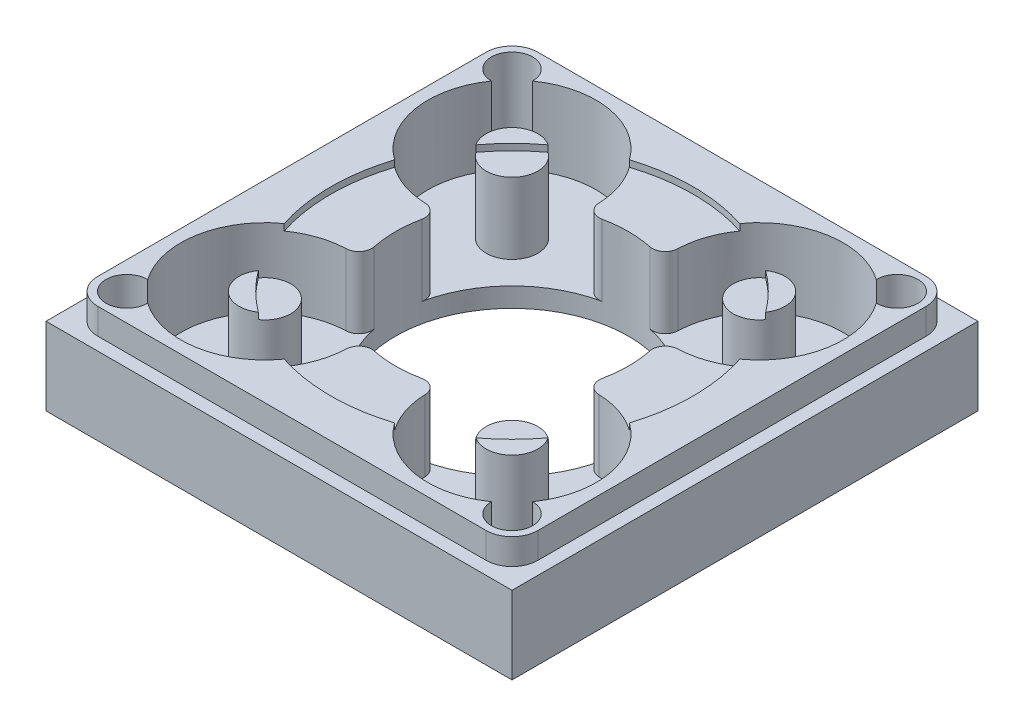
from build123d import *

# Parameters (mm, degrees)
SKETCH1_W           = 57.15
SKETCH1_H           = 57.15
SKETCH1_R           = 14.2875
BOSS_EXTRUDE1_DEPTH = 12.7
SKETCH2_W           = 57.15
SKETCH2_H           = 57.15
CUT_EXTRUDE1_DEPTH  = 3.175
SKETCH4_R           = 10.31875
SKETCH4_R_2         = 3.175
CUT_EXTRUDE3_DEPTH  = 9.525
SKETCH5_R           = 22.225
CUT_EXTRUDE4_DEPTH  = 0.79375
SKETCH6_R           = 2.54
CUT_EXTRUDE5_DEPTH  = 43.359783404
CUT_EXTRUDE6_START  = -0.79375
SKETCH8_R           = 22.225
CUT_EXTRUDE6_DEPTH  = 0.79375
FILLET1_R           = 1.5875


with BuildPart() as part:
    # Sketch1 → Boss-Extrude1 (new body)
    with BuildSketch(Plane(origin=(0, 0, 0), x_dir=(1, 0, 0), z_dir=(0, 1, 0))):
        Rectangle(SKETCH1_W, SKETCH1_H)
        Circle(SKETCH1_R, mode=Mode.SUBTRACT)
    extrude(amount=BOSS_EXTRUDE1_DEPTH)

    # Sketch2 → Cut-Extrude1 (cut)
    with BuildSketch(Plane(origin=(0, 12.7, 0), x_dir=(1, 0, 0), z_dir=(0, 1, 0))):
        Rectangle(SKETCH2_W, SKETCH2_H)
        with BuildLine():
            Line((-23.8125, -26.9875), (23.8125, -26.9875))
            ThreePointArc((23.8125, -26.9875), (26.05756403, -26.05756403), (26.9875, -23.8125))
            Line((26.9875, -23.8125), (26.9875, 23.8125))
            ThreePointArc((26.9875, 23.8125), (26.05756403, 26.05756403), (23.8125, 26.9875))
            Line((23.8125, 26.9875), (-23.8125, 26.9875))
            ThreePointArc((-23.8125, 26.9875), (-26.05756403, 26.05756403), (-26.9875, 23.8125))
            Line((-26.9875, 23.8125), (-26.9875, -23.8125))
            ThreePointArc((-26.9875, -23.8125), (-26.05756403, -26.05756403), (-23.8125, -26.9875))
        make_face(mode=Mode.SUBTRACT)
    extrude(amount=-CUT_EXTRUDE1_DEPTH, mode=Mode.SUBTRACT)

    # Sketch4 → Cut-Extrude3 (cut)
    # profile 1 of 4: a face of its own
    with BuildSketch(Plane(origin=(0, 12.7, 0), x_dir=(1, 0, 0), z_dir=(0, 1, 0))):
        with Locations((15.154182204, 15.154182204)):
            Circle(SKETCH4_R)
        with Locations((15.154182204, 15.154182204)):
            Circle(SKETCH4_R_2, mode=Mode.SUBTRACT)
    # profile 2 of 4: a face of its own
    with BuildSketch(Plane(origin=(0, 12.7, 0), x_dir=(1, 0, 0), z_dir=(0, 1, 0))):
        with Locations((15.154182204, -15.154182204)):
            Circle(SKETCH4_R)
        with Locations((15.154182204, -15.154182204)):
            Circle(SKETCH4_R_2, mode=Mode.SUBTRACT)
    # profile 3 of 4: a face of its own
    with BuildSketch(Plane(origin=(0, 12.7, 0), x_dir=(1, 0, 0), z_dir=(0, 1, 0))):
        with Locations((-15.154182204, -15.154182204)):
            Circle(SKETCH4_R)
        with Locations((-15.154182204, -15.154182204)):
            Circle(SKETCH4_R_2, mode=Mode.SUBTRACT)
    # profile 4 of 4: a face of its own
    with BuildSketch(Plane(origin=(0, 12.7, 0), x_dir=(1, 0, 0), z_dir=(0, 1, 0))):
        with Locations((-15.154182204, 15.154182204)):
            Circle(SKETCH4_R)
        with Locations((-15.154182204, 15.154182204)):
            Circle(SKETCH4_R_2, mode=Mode.SUBTRACT)
    extrude(amount=-CUT_EXTRUDE3_DEPTH, mode=Mode.SUBTRACT)

    # Sketch5 → Cut-Extrude4 (cut)
    with BuildSketch(Plane(origin=(0, 12.7, 0), x_dir=(1, 0, 0), z_dir=(0, 1, 0))):
        Circle(SKETCH5_R)
    extrude(amount=-CUT_EXTRUDE4_DEPTH, mode=Mode.SUBTRACT)

    # Sketch6 → Cut-Extrude5 (cut, through all)
    with BuildSketch(Plane.XZ):
        with Locations((-23.622, 23.622)):
            Circle(SKETCH6_R)
        with Locations((23.622, 23.622)):
            Circle(SKETCH6_R)
        with Locations((23.622, -23.622)):
            Circle(SKETCH6_R)
        with Locations((-23.622, -23.622)):
            Circle(SKETCH6_R)
    extrude(amount=-CUT_EXTRUDE5_DEPTH, mode=Mode.SUBTRACT)

    # Sketch8 → Cut-Extrude6 (cut)
    with BuildSketch(Plane.XZ.offset(CUT_EXTRUDE6_START)):
        Circle(SKETCH8_R)
    extrude(amount=CUT_EXTRUDE6_DEPTH, mode=Mode.SUBTRACT)

    # Fillet1
    fillet1_edges = [part.edges().sort_by_distance(p)[0] for p in [
        (4.987590699, 7.540625, -13.388674142),
        (-4.987590699, 7.540625, -13.388674142),
        (-13.388674142, 7.540625, -4.987590699),
        (-13.388674142, 7.540625, 4.987590699),
        (-4.987590699, 7.540625, 13.388674142),
        (4.987590699, 7.540625, 13.388674142),
        (13.388674142, 7.540625, 4.987590699),
        (13.388674142, 7.540625, -4.987590699),
    ]]
    fillet(fillet1_edges, radius=FILLET1_R)


solid = part.part
